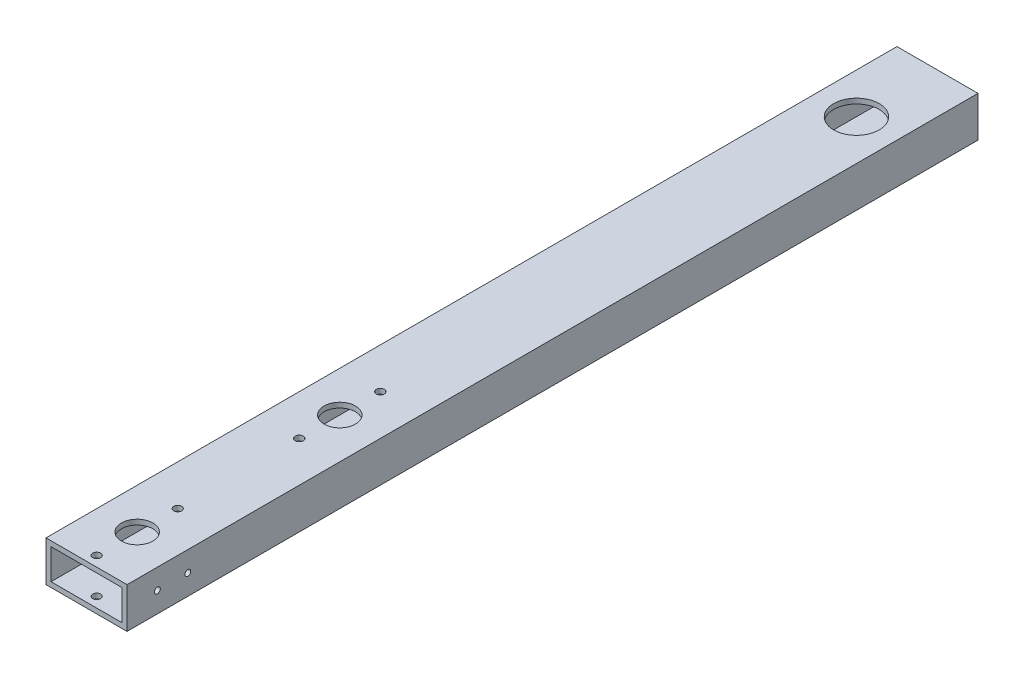
from build123d import *

# Parameters (mm, degrees)
SKETCH1_W                   = 50.8
SKETCH1_H                   = 25.4
BOSS_EXTRUDE1_DEPTH         = 266.7
SKETCH2_W                   = 44.45
SKETCH2_H                   = 19.05
CUT_EXTRUDE1_DEPTH          = 535.155417458
SKETCH5_R                   = 2.4892
SKETCH5_R_2                 = 9.84885
SKETCH5_R_3                 = 14.2875
CUT_EXTRUDE2_DEPTH          = 508
SKETCH7_R                   = 9.84885
SKETCH7_R_2                 = 2.5527
CUT_EXTRUDE4_DEPTH          = 270.108175275
F_27_0_144_DIAMETER_HOLE1_D = 3.6576


with BuildPart() as part:
    # Sketch1 → Boss-Extrude1 (new, symmetric)
    with BuildSketch(Plane.XY):
        Rectangle(SKETCH1_W, SKETCH1_H)
    extrude(amount=BOSS_EXTRUDE1_DEPTH, both=True)

    # Sketch2 → Cut-Extrude1 (cut, through all)
    with BuildSketch(Plane.XY.offset(266.7)):
        Rectangle(SKETCH2_W, SKETCH2_H)
    extrude(amount=-CUT_EXTRUDE1_DEPTH, mode=Mode.SUBTRACT)

    # Sketch5 → Cut-Extrude2 (cut)
    with BuildSketch(Plane(origin=(0, 12.7, 0), x_dir=(1, 0, 0), z_dir=(0, 1, 0))):
        with Locations((0, -260.35)):
            Circle(SKETCH5_R)
        with Locations((0, -234.95)):
            Circle(SKETCH5_R_2)
        with Locations((0, -209.55)):
            Circle(SKETCH5_R)
        with Locations((0, 215.9)):
            Circle(SKETCH5_R_3)
    extrude(amount=-CUT_EXTRUDE2_DEPTH, mode=Mode.SUBTRACT)

    # Sketch7 → Cut-Extrude4 (cut, through all)
    with BuildSketch(Plane(origin=(0, 12.7, 0), x_dir=(1, 0, 0), z_dir=(0, 1, 0))):
        with Locations((0, -107.95)):
            Circle(SKETCH7_R)
        with Locations((0, -133.35)):
            Circle(SKETCH7_R_2)
        with Locations((0, -82.55)):
            Circle(SKETCH7_R_2)
    extrude(amount=-CUT_EXTRUDE4_DEPTH, mode=Mode.SUBTRACT)

    # #27 (0.144) Diameter Hole1 (through all)
    with Locations(Plane(origin=(25.4, 0, 0), x_dir=(0, 0, -1), z_dir=(1, 0, 0))):
        with Locations((-247.65, 0), (-228.6, 0)):
            Hole(F_27_0_144_DIAMETER_HOLE1_D / 2)


solid = part.part
